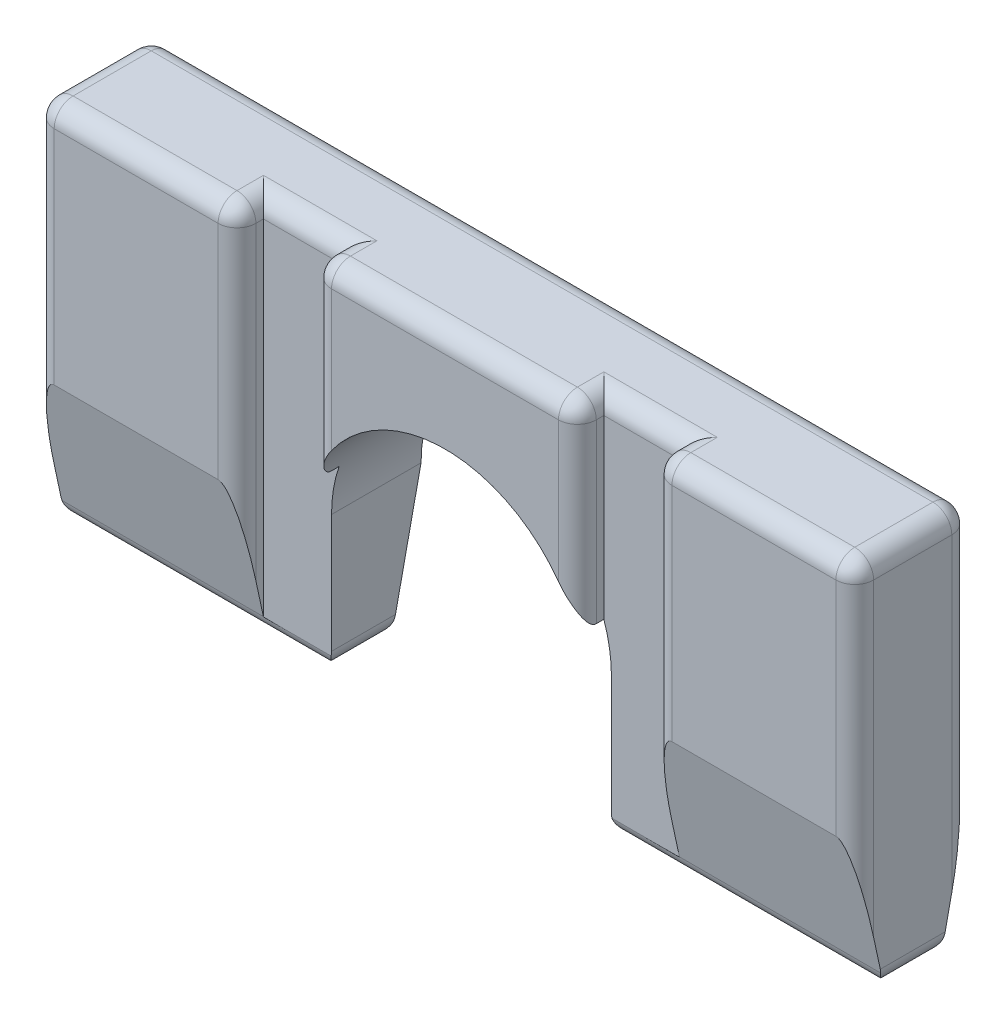
from build123d import *

# Parameters (mm, degrees)
EXTRUDE_1_DEPTH     = 9.2
SKETCH_3_W          = 6
SKETCH_3_H          = 30
CUT_EXTRUDE_2_DEPTH = 2.1
CUT_EXTRUDE_1_REACH = 69.34
FILLET_1_R          = 1.5


with BuildPart() as part:
    # 凸台-拉伸1: read off the stored shape, not the designer's step
    # 凸台-拉伸1 outline → 凸台-拉伸1 (new body)
    with BuildSketch(Plane.XY):
        with BuildLine():
            Line((11.1, -15), (32.5, -15))
            Line((32.5, -15), (32.5, 15))
            Line((32.5, 15), (-32.5, 15))
            Line((-32.5, 15), (-32.5, -15))
            Line((-32.5, -15), (-11.1, -15))
            Line((-11.1, -15), (-11.1, -4.1))
            ThreePointArc((-11.1, -4.1), (0, 7), (11.1, -4.1))
            Line((11.1, -4.1), (11.1, -15))
        make_face()
    extrude(amount=EXTRUDE_1_DEPTH)

    # 草图3 → 切除-拉伸2 (cut)
    with BuildSketch(Plane.XY.offset(9.2)):
        with Locations((-13.5, 0)):
            Rectangle(SKETCH_3_W, SKETCH_3_H)
        with Locations((13.5, 0)):
            Rectangle(SKETCH_3_W, SKETCH_3_H)
    extrude(amount=-CUT_EXTRUDE_2_DEPTH, mode=Mode.SUBTRACT)

    # 切除-拉伸1: up to this face of the body (flat: up to its plane)
    cut_extrude_1_end = Plane(part.part.faces().sort_by_distance((-32.5, 0, 4.6))[0])
    # 草图2 → 切除-拉伸1 (cut, up to the picked face)
    with BuildSketch(Plane(origin=(32.5, 0, 0), x_dir=(0, 0, -1), z_dir=(1, 0, 0)), mode=Mode.PRIVATE) as cut_extrude_1_sk1:
        Polygon((-6.85, -15), (-9.2, -4.1), (-9.2, -15), align=None)
    cut_extrude_1_tool1 = split(extrude(cut_extrude_1_sk1.sketch, amount=-CUT_EXTRUDE_1_REACH, mode=Mode.PRIVATE), bisect_by=cut_extrude_1_end, keep=Keep.BOTH, mode=Mode.PRIVATE)
    # 草图2 → 切除-拉伸1 (cut, up to the picked face)
    with BuildSketch(Plane(origin=(32.5, 0, 0), x_dir=(0, 0, -1), z_dir=(1, 0, 0)), mode=Mode.PRIVATE) as cut_extrude_1_sk2:
        Polygon((0, -4.1), (-2.35, -15), (0, -15), align=None)
    cut_extrude_1_tool2 = split(extrude(cut_extrude_1_sk2.sketch, amount=-CUT_EXTRUDE_1_REACH, mode=Mode.PRIVATE), bisect_by=cut_extrude_1_end, keep=Keep.BOTH, mode=Mode.PRIVATE)
    add(cut_extrude_1_tool1.solids().sort_by(Axis((32.5, -11.366667, 8.416667), (-1, 0, 0)))[0], mode=Mode.SUBTRACT)
    add(cut_extrude_1_tool2.solids().sort_by(Axis((32.5, -11.366667, 0.783333), (-1, 0, 0)))[0], mode=Mode.SUBTRACT)

    # 圆角1
    # the kernel refuses this fillet: 1.5 mm, written as the material it takes off along each edge
    with BuildSketch(Plane(origin=(-31, 13.5, 7.7), x_dir=(0, 0, 1), z_dir=(-1, 0, 0))) as fillet_1_piece_1_section:
        Polygon((0, 0), (FILLET_1_R, 0), (FILLET_1_R, FILLET_1_R), (0, FILLET_1_R), align=None)
    fillet_1_piece_1 = extrude(amount=FILLET_1_R, mode=Mode.PRIVATE)
    fillet_1_piece_1 = fillet_1_piece_1 - Plane(origin=(-31, 13.5, 7.7), x_dir=(0, -0.7071067811865475, -0.7071067811865475), z_dir=(-1, 0, 0)) * Sphere(FILLET_1_R, mode=Mode.PRIVATE)
    add(fillet_1_piece_1, mode=Mode.SUBTRACT)
    with BuildSketch(Plane(origin=(-31, 13.5, 1.5), x_dir=(0, 1, 0), z_dir=(-1, 0, 0))) as fillet_1_piece_2_section:
        Polygon((0, 0), (FILLET_1_R, 0), (FILLET_1_R, FILLET_1_R), (0, FILLET_1_R), align=None)
    fillet_1_piece_2 = extrude(amount=FILLET_1_R, mode=Mode.PRIVATE)
    fillet_1_piece_2 = fillet_1_piece_2 - Plane(origin=(-31, 13.5, 1.5), x_dir=(0, -0.7071067811865475, 0.7071067811865475), z_dir=(-1, 0, 0)) * Sphere(FILLET_1_R, mode=Mode.PRIVATE)
    add(fillet_1_piece_2, mode=Mode.SUBTRACT)
    with BuildSketch(Plane(origin=(31, 13.5, 1.5), x_dir=(1, 0, 0), z_dir=(0, 1, 0))) as fillet_1_piece_3_section:
        Polygon((0, 0), (FILLET_1_R, 0), (FILLET_1_R, FILLET_1_R), (0, FILLET_1_R), align=None)
    fillet_1_piece_3 = extrude(amount=FILLET_1_R, mode=Mode.PRIVATE)
    fillet_1_piece_3 = fillet_1_piece_3 - Plane(origin=(31, 13.5, 1.5), x_dir=(-0.7071067811865475, 0, 0.7071067811865475), z_dir=(0, 1, 0)) * Sphere(FILLET_1_R, mode=Mode.PRIVATE)
    add(fillet_1_piece_3, mode=Mode.SUBTRACT)
    with BuildSketch(Plane(origin=(31, 13.5, 7.7), x_dir=(0, 1, 0), z_dir=(0, 0, 1))) as fillet_1_piece_4_section:
        Polygon((0, 0), (FILLET_1_R, 0), (FILLET_1_R, -FILLET_1_R), (0, -FILLET_1_R), align=None)
    fillet_1_piece_4 = extrude(amount=FILLET_1_R, mode=Mode.PRIVATE)
    fillet_1_piece_4 = fillet_1_piece_4 - Plane(origin=(31, 13.5, 7.7), x_dir=(-0.7071067811865475, -0.7071067811865475, 0), z_dir=(0, 0, 1)) * Sphere(FILLET_1_R, mode=Mode.PRIVATE)
    add(fillet_1_piece_4, mode=Mode.SUBTRACT)
    with BuildSketch(Plane(origin=(18, 13.5, 7.7), x_dir=(-1, 0, 0), z_dir=(0, 0, 1))) as fillet_1_piece_5_section:
        Polygon((0, 0), (FILLET_1_R, 0), (FILLET_1_R, -FILLET_1_R), (0, -FILLET_1_R), align=None)
    fillet_1_piece_5 = extrude(amount=FILLET_1_R, mode=Mode.PRIVATE)
    fillet_1_piece_5 = fillet_1_piece_5 - Plane(origin=(18, 13.5, 7.7), x_dir=(0.7071067811865476, -0.7071067811865475, 0), z_dir=(0, 0, 1)) * Sphere(FILLET_1_R, mode=Mode.PRIVATE)
    add(fillet_1_piece_5, mode=Mode.SUBTRACT)
    with BuildSketch(Plane(origin=(-18, 13.5, 7.7), x_dir=(0, 1, 0), z_dir=(1, 0, 0))) as fillet_1_piece_6_section:
        Polygon((0, 0), (FILLET_1_R, 0), (FILLET_1_R, FILLET_1_R), (0, FILLET_1_R), align=None)
    fillet_1_piece_6 = extrude(amount=FILLET_1_R, mode=Mode.PRIVATE)
    fillet_1_piece_6 = fillet_1_piece_6 - Plane(origin=(-18, 13.5, 7.7), x_dir=(0, -0.7071067811865475, -0.7071067811865475), z_dir=(1, 0, 0)) * Sphere(FILLET_1_R, mode=Mode.PRIVATE)
    add(fillet_1_piece_6, mode=Mode.SUBTRACT)
    with BuildSketch(Plane(origin=(-9, 13.5, 7.7), x_dir=(0, 0, 1), z_dir=(0, 1, 0))) as fillet_1_piece_7_section:
        Polygon((0, 0), (FILLET_1_R, 0), (FILLET_1_R, -FILLET_1_R), (0, -FILLET_1_R), align=None)
    fillet_1_piece_7 = extrude(amount=FILLET_1_R, mode=Mode.PRIVATE)
    fillet_1_piece_7 = fillet_1_piece_7 - Plane(origin=(-9, 13.5, 7.7), x_dir=(0.7071067811865475, 0, -0.7071067811865475), z_dir=(0, 1, 0)) * Sphere(FILLET_1_R, mode=Mode.PRIVATE)
    add(fillet_1_piece_7, mode=Mode.SUBTRACT)
    with BuildSketch(Plane(origin=(9, 13.5, 7.7), x_dir=(1, 0, 0), z_dir=(0, 1, 0))) as fillet_1_piece_8_section:
        Polygon((0, 0), (FILLET_1_R, 0), (FILLET_1_R, -FILLET_1_R), (0, -FILLET_1_R), align=None)
    fillet_1_piece_8 = extrude(amount=FILLET_1_R, mode=Mode.PRIVATE)
    fillet_1_piece_8 = fillet_1_piece_8 - Plane(origin=(9, 13.5, 7.7), x_dir=(-0.7071067811865475, 0, -0.7071067811865475), z_dir=(0, 1, 0)) * Sphere(FILLET_1_R, mode=Mode.PRIVATE)
    add(fillet_1_piece_8, mode=Mode.SUBTRACT)
    with BuildSketch(Plane(origin=(-8.072322791, -15, 6.85), x_dir=(0, 0.9775391614749971, 0.2107538559143334), z_dir=(-1, 0, 0))) as fillet_1_piece_9:
        with BuildLine():
            CenterArc((FILLET_1_R * 0.807380589126, FILLET_1_R), FILLET_1_R, 192.166533775, 77.833466225)
            Line((-FILLET_1_R * 0.170158572349, FILLET_1_R * 0.789246144086), (0, 0))
            Line((0, 0), (FILLET_1_R * 0.807380589126, 0))
        make_face()
    extrude(amount=27.455354418, mode=Mode.SUBTRACT)
    with BuildSketch(Plane(origin=(-8.072322791, -15, 2.35), x_dir=(0, 0.977539161474997, -0.21075385591433374), z_dir=(-1, 0, 0)), Plane(origin=(35.527677209, -15, 6.85), x_dir=(0, 0, -1), z_dir=(-1, 0, 0)), Plane(origin=(35.527677209, -15, 2.35), x_dir=(0, 0.977539161474997, -0.21075385591433374), z_dir=(-1, 0, 0))) as fillet_1_piece_10:
        with BuildLine():
            CenterArc((FILLET_1_R * 0.807380589126, -FILLET_1_R), FILLET_1_R, 90, 77.833466225)
            Line((-FILLET_1_R * 0.170158572349, -FILLET_1_R * 0.789246144086), (0, 0))
            Line((0, 0), (FILLET_1_R * 0.807380589126, 0))
        make_face()
    extrude(amount=27.455354418, mode=Mode.SUBTRACT)
    with BuildSketch(Plane(origin=(-11.1, -15, -1.4), x_dir=(0, 1, 0), z_dir=(0, 0, 1))) as fillet_1_piece_11:
        with BuildLine():
            CenterArc((FILLET_1_R, FILLET_1_R), FILLET_1_R, 180, 90)
            Line((0, FILLET_1_R), (0, 0))
            Line((0, 0), (FILLET_1_R, 0))
        make_face()
    extrude(amount=12, mode=Mode.SUBTRACT)
    with BuildSketch(Plane(origin=(11.1, -15, -1.4), x_dir=(0, 1, 0), z_dir=(0, 0, 1)), Plane(origin=(32.5, -15, -1.4), x_dir=(-1, 0, 0), z_dir=(0, 0, 1)), Plane(origin=(-32.5, -15, -1.4), x_dir=(0, 1, 0), z_dir=(0, 0, 1))) as fillet_1_piece_12:
        with BuildLine():
            CenterArc((FILLET_1_R, -FILLET_1_R), FILLET_1_R, 90, 90)
            Line((0, -FILLET_1_R), (0, 0))
            Line((0, 0), (FILLET_1_R, 0))
        make_face()
    extrude(amount=12, mode=Mode.SUBTRACT)
    with BuildSketch(Plane(origin=(-32.5, 13.5, 9.2), x_dir=(0, 0, -1), z_dir=(0, -1, 0)), Plane(origin=(-32.5, 13.5, 0), x_dir=(1, 0, 0), z_dir=(0, -1, 0)), Plane(origin=(32.5, -15.35, 9.2), x_dir=(0, 0, -1), z_dir=(0, 1, 0)), Plane(origin=(-16.5, 13.5, 9.2), x_dir=(-1, 0, 0), z_dir=(0, -1, 0))) as fillet_1_piece_13:
        with BuildLine():
            CenterArc((FILLET_1_R, FILLET_1_R), FILLET_1_R, 180, 90)
            Line((0, FILLET_1_R), (0, 0))
            Line((0, 0), (FILLET_1_R, 0))
        make_face()
    extrude(amount=28.85, mode=Mode.SUBTRACT)
    with BuildSketch(Plane(origin=(32.5, -15.35, 0), x_dir=(0, 0, 1), z_dir=(0, 1, 0)), Plane(origin=(16.5, 13.5, 9.2), x_dir=(1, 0, 0), z_dir=(0, -1, 0))) as fillet_1_piece_14:
        with BuildLine():
            CenterArc((FILLET_1_R, -FILLET_1_R), FILLET_1_R, 90, 90)
            Line((0, -FILLET_1_R), (0, 0))
            Line((0, 0), (FILLET_1_R, 0))
        make_face()
    extrude(amount=28.85, mode=Mode.SUBTRACT)
    with BuildSketch(Plane(origin=(32.5, 15, 1.5), x_dir=(0, -1, 0), z_dir=(0, 0, 1)), Plane(origin=(-32.5, 15, 1.5), x_dir=(1, 0, 0), z_dir=(0, 0, 1))) as fillet_1_piece_15:
        with BuildLine():
            CenterArc((FILLET_1_R, -FILLET_1_R), FILLET_1_R, 90, 90)
            Line((0, -FILLET_1_R), (0, 0))
            Line((0, 0), (FILLET_1_R, 0))
        make_face()
    extrude(amount=6.2, mode=Mode.SUBTRACT)
    with BuildSketch(Plane(origin=(31, 15, 0), x_dir=(0, -1, 0), z_dir=(-1, 0, 0))) as fillet_1_piece_16:
        with BuildLine():
            CenterArc((FILLET_1_R, FILLET_1_R), FILLET_1_R, 180, 90)
            Line((0, FILLET_1_R), (0, 0))
            Line((0, 0), (FILLET_1_R, 0))
        make_face()
    extrude(amount=62, mode=Mode.SUBTRACT)
    with BuildSketch(Plane(origin=(31, 15, 9.2), x_dir=(0, -1, 0), z_dir=(-1, 0, 0))) as fillet_1_piece_17:
        with BuildLine():
            CenterArc((FILLET_1_R, -FILLET_1_R), FILLET_1_R, 90, 90)
            Line((0, -FILLET_1_R), (0, 0))
            Line((0, 0), (FILLET_1_R, 0))
        make_face()
    extrude(amount=13, mode=Mode.SUBTRACT)
    with BuildSketch(Plane(origin=(-18, 15, 9.2), x_dir=(0, 0, -1), z_dir=(-1, 0, 0))) as fillet_1_piece_18:
        with BuildLine():
            CenterArc((FILLET_1_R, FILLET_1_R), FILLET_1_R, 180, 90)
            Line((0, FILLET_1_R), (0, 0))
            Line((0, 0), (FILLET_1_R, 0))
        make_face()
    extrude(amount=13, mode=Mode.SUBTRACT)
    with BuildSketch(Plane(origin=(-10.5, -4.25, 9.2), x_dir=(1, 0, 0), z_dir=(0, 1, 0)), Plane(origin=(10.5, -4.25, 9.2), x_dir=(0, 0, -1), z_dir=(0, 1, 0))) as fillet_1_piece_19:
        with BuildLine():
            CenterArc((FILLET_1_R, FILLET_1_R), FILLET_1_R, 180, 90)
            Line((0, FILLET_1_R), (0, 0))
            Line((0, 0), (FILLET_1_R, 0))
        make_face()
    extrude(amount=17.75, mode=Mode.SUBTRACT)
    with BuildSketch(Plane(origin=(16.5, 15, 7.7), x_dir=(0, -1, 0), z_dir=(0, 0, -1)), Plane(origin=(10.5, 15, 7.7), x_dir=(-1, 0, 0), z_dir=(0, 0, -1)), Plane(origin=(-16.5, 15, 7.7), x_dir=(-1, 0, 0), z_dir=(0, 0, -1))) as fillet_1_piece_20:
        with BuildLine():
            CenterArc((FILLET_1_R, -FILLET_1_R), FILLET_1_R, 90, 90)
            Line((0, -FILLET_1_R), (0, 0))
            Line((0, 0), (FILLET_1_R, 0))
        make_face()
    extrude(amount=0.6, mode=Mode.SUBTRACT)
    with BuildSketch(Plane(origin=(10.5, 15, 7.1), x_dir=(0, -1, 0), z_dir=(1, 0, 0)), Plane(origin=(-10.5, 15, 7.1), x_dir=(0, 0, -1), z_dir=(-1, 0, 0))) as fillet_1_piece_21:
        with BuildLine():
            CenterArc((FILLET_1_R, FILLET_1_R), FILLET_1_R, 180, 90)
            Line((0, FILLET_1_R), (0, 0))
            Line((0, 0), (FILLET_1_R, 0))
        make_face()
    extrude(amount=6, mode=Mode.SUBTRACT)
    with BuildSketch(Plane(origin=(9, 15, 9.2), x_dir=(0, 0, -1), z_dir=(-1, 0, 0))) as fillet_1_piece_22:
        with BuildLine():
            CenterArc((FILLET_1_R, FILLET_1_R), FILLET_1_R, 180, 90)
            Line((0, FILLET_1_R), (0, 0))
            Line((0, 0), (FILLET_1_R, 0))
        make_face()
    extrude(amount=18, mode=Mode.SUBTRACT)
    with BuildSketch(Plane(origin=(-10.5, 15, 7.7), x_dir=(1, 0, 0), z_dir=(0, 0, -1))) as fillet_1_piece_23:
        with BuildLine():
            CenterArc((FILLET_1_R, FILLET_1_R), FILLET_1_R, 180, 90)
            Line((0, FILLET_1_R), (0, 0))
            Line((0, 0), (FILLET_1_R, 0))
        make_face()
    extrude(amount=0.6, mode=Mode.SUBTRACT)
    with BuildSketch(Plane(origin=(10.5, 15, 7.1), x_dir=(0, -1, 0), z_dir=(1, 0, 0))) as fillet_1_piece_24a_section:
        with BuildLine():
            CenterArc((FILLET_1_R, FILLET_1_R), FILLET_1_R, 180, 90)
            Line((0, FILLET_1_R), (0, 0))
            Line((0, 0), (FILLET_1_R, 0))
        make_face()
    fillet_1_piece_24a = extrude(amount=9.75, mode=Mode.PRIVATE)
    fillet_1_piece_24a = split(fillet_1_piece_24a, bisect_by=Plane(origin=(16.5, 15, 7.1), z_dir=(1, 0, 0)), keep=Keep.TOP, mode=Mode.PRIVATE)
    with BuildSketch(Plane(origin=(16.5, 15, 7.7), x_dir=(0, -1, 0), z_dir=(0, 0, -1))) as fillet_1_piece_24b_section:
        with BuildLine():
            CenterArc((FILLET_1_R, -FILLET_1_R), FILLET_1_R, 90, 90)
            Line((0, -FILLET_1_R), (0, 0))
            Line((0, 0), (FILLET_1_R, 0))
        make_face()
    fillet_1_piece_24b = extrude(amount=4.35, mode=Mode.PRIVATE)
    fillet_1_piece_24b = split(fillet_1_piece_24b, bisect_by=Plane(origin=(16.5, 15, 7.1), z_dir=(0, 0, -1)), keep=Keep.TOP, mode=Mode.PRIVATE)
    fillet_1_piece_24 = fillet_1_piece_24a & fillet_1_piece_24b
    add(fillet_1_piece_24, mode=Mode.SUBTRACT)
    with BuildSketch(Plane(origin=(6.75, 15, 7.1), x_dir=(0, -1, 0), z_dir=(1, 0, 0))) as fillet_1_piece_25a_section:
        with BuildLine():
            CenterArc((FILLET_1_R, FILLET_1_R), FILLET_1_R, 180, 90)
            Line((0, FILLET_1_R), (0, 0))
            Line((0, 0), (FILLET_1_R, 0))
        make_face()
    fillet_1_piece_25a = extrude(amount=9.75, mode=Mode.PRIVATE)
    fillet_1_piece_25a = split(fillet_1_piece_25a, bisect_by=Plane(origin=(10.5, 15, 7.1), z_dir=(-1, 0, 0)), keep=Keep.TOP, mode=Mode.PRIVATE)
    with BuildSketch(Plane(origin=(10.5, 15, 7.7), x_dir=(-1, 0, 0), z_dir=(0, 0, -1))) as fillet_1_piece_25b_section:
        with BuildLine():
            CenterArc((FILLET_1_R, -FILLET_1_R), FILLET_1_R, 90, 90)
            Line((0, -FILLET_1_R), (0, 0))
            Line((0, 0), (FILLET_1_R, 0))
        make_face()
    fillet_1_piece_25b = extrude(amount=4.35, mode=Mode.PRIVATE)
    fillet_1_piece_25b = split(fillet_1_piece_25b, bisect_by=Plane(origin=(10.5, 15, 7.1), z_dir=(0, 0, -1)), keep=Keep.TOP, mode=Mode.PRIVATE)
    fillet_1_piece_25 = fillet_1_piece_25a & fillet_1_piece_25b
    add(fillet_1_piece_25, mode=Mode.SUBTRACT)
    with BuildSketch(Plane(origin=(-6.75, 15, 7.1), x_dir=(0, 0, -1), z_dir=(-1, 0, 0))) as fillet_1_piece_26a_section:
        with BuildLine():
            CenterArc((FILLET_1_R, FILLET_1_R), FILLET_1_R, 180, 90)
            Line((0, FILLET_1_R), (0, 0))
            Line((0, 0), (FILLET_1_R, 0))
        make_face()
    fillet_1_piece_26a = extrude(amount=9.75, mode=Mode.PRIVATE)
    fillet_1_piece_26a = split(fillet_1_piece_26a, bisect_by=Plane(origin=(-10.5, 15, 7.1), z_dir=(1, 0, 0)), keep=Keep.TOP, mode=Mode.PRIVATE)
    with BuildSketch(Plane(origin=(-10.5, 15, 7.7), x_dir=(1, 0, 0), z_dir=(0, 0, -1))) as fillet_1_piece_26b_section:
        with BuildLine():
            CenterArc((FILLET_1_R, FILLET_1_R), FILLET_1_R, 180, 90)
            Line((0, FILLET_1_R), (0, 0))
            Line((0, 0), (FILLET_1_R, 0))
        make_face()
    fillet_1_piece_26b = extrude(amount=4.35, mode=Mode.PRIVATE)
    fillet_1_piece_26b = split(fillet_1_piece_26b, bisect_by=Plane(origin=(-10.5, 15, 7.1), z_dir=(0, 0, -1)), keep=Keep.TOP, mode=Mode.PRIVATE)
    fillet_1_piece_26 = fillet_1_piece_26a & fillet_1_piece_26b
    add(fillet_1_piece_26, mode=Mode.SUBTRACT)
    with BuildSketch(Plane(origin=(-16.5, 15, 7.7), x_dir=(-1, 0, 0), z_dir=(0, 0, -1))) as fillet_1_piece_27a_section:
        with BuildLine():
            CenterArc((FILLET_1_R, -FILLET_1_R), FILLET_1_R, 90, 90)
            Line((0, -FILLET_1_R), (0, 0))
            Line((0, 0), (FILLET_1_R, 0))
        make_face()
    fillet_1_piece_27a = extrude(amount=4.35, mode=Mode.PRIVATE)
    fillet_1_piece_27a = split(fillet_1_piece_27a, bisect_by=Plane(origin=(-16.5, 15, 7.1), z_dir=(0, 0, -1)), keep=Keep.TOP, mode=Mode.PRIVATE)
    with BuildSketch(Plane(origin=(-10.5, 15, 7.1), x_dir=(0, 0, -1), z_dir=(-1, 0, 0))) as fillet_1_piece_27b_section:
        with BuildLine():
            CenterArc((FILLET_1_R, FILLET_1_R), FILLET_1_R, 180, 90)
            Line((0, FILLET_1_R), (0, 0))
            Line((0, 0), (FILLET_1_R, 0))
        make_face()
    fillet_1_piece_27b = extrude(amount=9.75, mode=Mode.PRIVATE)
    fillet_1_piece_27b = split(fillet_1_piece_27b, bisect_by=Plane(origin=(-16.5, 15, 7.1), z_dir=(-1, 0, 0)), keep=Keep.TOP, mode=Mode.PRIVATE)
    fillet_1_piece_27 = fillet_1_piece_27a & fillet_1_piece_27b
    add(fillet_1_piece_27, mode=Mode.SUBTRACT)


solid = part.part
